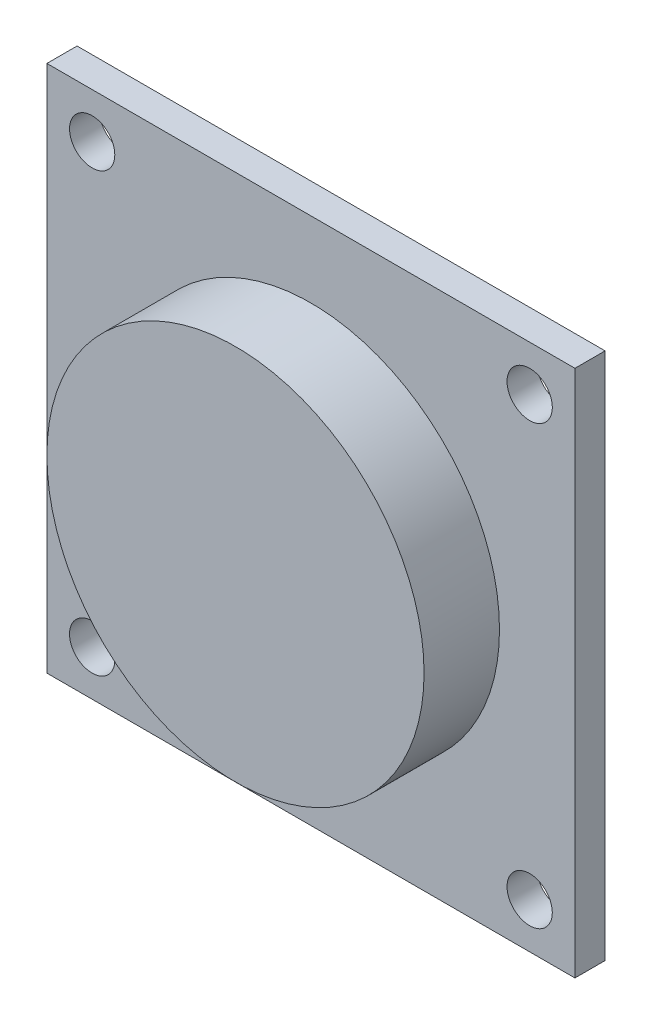
from build123d import *

# Parameters (mm, degrees)
SKETCH1_W           = 70
SKETCH1_H           = 70
BOSS_EXTRUDE1_DEPTH = 4
SKETCH2_R           = 25
BOSS_EXTRUDE2_DEPTH = 10
SKETCH3_R           = 25
CUT_EXTRUDE1_DEPTH  = 4
FILLET1_R           = 4
SKETCH4_R           = 3.000311633
CUT_EXTRUDE2_DEPTH  = 4


with BuildPart() as part:
    # Sketch1 → Boss-Extrude1 (new body)
    with BuildSketch(Plane.XY):
        Rectangle(SKETCH1_W, SKETCH1_H)
    extrude(amount=BOSS_EXTRUDE1_DEPTH)

    # Sketch2 → Boss-Extrude2 (add)
    with BuildSketch(Plane.XY.offset(4)):
        with Locations(Location((0, 0, 0), (0, 0, 180))):
            Circle(SKETCH2_R)
    extrude(amount=BOSS_EXTRUDE2_DEPTH)

    # Sketch3 → Cut-Extrude1 (cut)
    with BuildSketch(Plane(origin=(0, 0, 0), x_dir=(-1, 0, 0), z_dir=(0, 0, -1))):
        Circle(SKETCH3_R)
    extrude(amount=-CUT_EXTRUDE1_DEPTH, mode=Mode.SUBTRACT)


with BuildPart() as cut_extrude1_piece_1:
    # of the separate pieces the step leaves, piece 1, a body of its own (cut_extrude1_pieces)
    add(part.part.solids().sort_by_distance((-25, 0, 14))[0])


with BuildPart() as cut_extrude1_piece_2:
    # of the separate pieces the step leaves, piece 2, a body of its own (cut_extrude1_pieces)
    add(part.part.solids().sort_by_distance((35, 35, 0))[0])

    # Fillet1
    fillet1_edges = [cut_extrude1_piece_2.edges().sort_by_distance(p)[0] for p in [
        (25, 0, 0),
    ]]
    fillet(fillet1_edges, radius=FILLET1_R - 0.0001)  # a hair under: the kernel refuses the full size

    # Sketch4 → Cut-Extrude2 (cut)
    with BuildSketch(Plane.XY.offset(4)):
        with Locations((-29, 29)):
            Circle(SKETCH4_R)
        with Locations(Location((29, 29, 0), (0, 0, 180))):
            Circle(SKETCH4_R)
        with Locations(Location((-29, -29, 0), (0, 0, 180))):
            Circle(SKETCH4_R)
        with Locations((29, -29)):
            Circle(SKETCH4_R)
    extrude(amount=-CUT_EXTRUDE2_DEPTH, mode=Mode.SUBTRACT)


solid = Compound([cut_extrude1_piece_1.part, cut_extrude1_piece_2.part])
